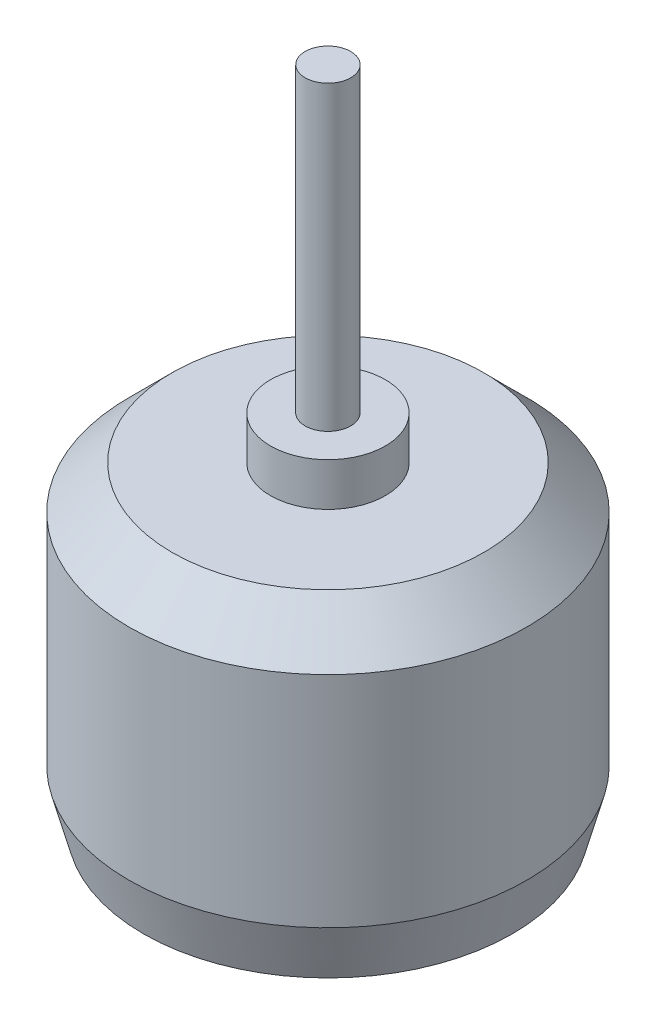
from build123d import *

# Parameters (mm, degrees)
SKETCH1_R                 = 13.85
BOSS_EXTRUDE1_DEPTH       = 22
SKETCH2_R                 = 4
BOSS_EXTRUDE2_DEPTH       = 3
SKETCH3_R                 = 1.5875
BOSS_EXTRUDE3_DEPTH       = 11
CHAMFER1_SIZE             = 3
CHAMFER2_SIZE             = 1
CHAMFER2_SIZE2            = 3.732050808
SKETCH4_R                 = 3.25
BOSS_EXTRUDE4_DEPTH       = 1
M3X0_5_TAPPED_HOLE1_D     = 2.5
M3X0_5_TAPPED_HOLE1_DEPTH = 7.5
M3X0_5_TAPPED_HOLE1_TIP   = 0.751075774
SKETCH9_R                 = 1.5875
BOSS_EXTRUDE5_DEPTH       = 10


with BuildPart() as part:
    # Sketch1 → Boss-Extrude1 (new body)
    with BuildSketch(Plane(origin=(0, 0, 0), x_dir=(1, 0, 0), z_dir=(0, 1, 0))):
        Circle(SKETCH1_R)
    extrude(amount=BOSS_EXTRUDE1_DEPTH)

    # Sketch2 → Boss-Extrude2 (add)
    with BuildSketch(Plane(origin=(0, 22, 0), x_dir=(1, 0, 0), z_dir=(0, 1, 0))):
        Circle(SKETCH2_R)
    extrude(amount=BOSS_EXTRUDE2_DEPTH)

    # Sketch3 → Boss-Extrude3 (add)
    with BuildSketch(Plane(origin=(0, 25, 0), x_dir=(1, 0, 0), z_dir=(0, 1, 0))):
        Circle(SKETCH3_R)
    extrude(amount=BOSS_EXTRUDE3_DEPTH)

    # Chamfer1
    chamfer1_edges = [part.edges().sort_by_distance(p)[0] for p in [
        (-13.85, 22, 0),
    ]]
    chamfer(chamfer1_edges, length=CHAMFER1_SIZE)

    # Chamfer2
    chamfer2_edges = [part.edges().sort_by_distance(p)[0] for p in [
        (-13.85, 0, 0),
    ]]
    chamfer2_side = [part.faces().sort_by_distance(p)[0] for p in [
        (0, 0, 0),
    ]]
    chamfer(chamfer2_edges, length=CHAMFER2_SIZE, length2=CHAMFER2_SIZE2, reference=chamfer2_side[0])

    # Sketch4 → Boss-Extrude4 (add)
    with BuildSketch(Plane.XZ):
        Circle(SKETCH4_R)
    extrude(amount=BOSS_EXTRUDE4_DEPTH)

    # M3x0.5 Tapped Hole1
    with Locations(Plane(origin=(0, 0, 0), x_dir=(-1, 0, 0), z_dir=(0, -1, 0))):
        with Locations((5.656854249, -5.656854249), (-6.717514421, -6.717514421), (-5.656854249, 5.656854249), (6.717514421, 6.717514421)):
            Hole(M3X0_5_TAPPED_HOLE1_D / 2, depth=M3X0_5_TAPPED_HOLE1_DEPTH)
            with Locations((0, 0, -(M3X0_5_TAPPED_HOLE1_DEPTH + M3X0_5_TAPPED_HOLE1_TIP / 2))):  # 118° drill point
                Cone(0, M3X0_5_TAPPED_HOLE1_D / 2, M3X0_5_TAPPED_HOLE1_TIP, mode=Mode.SUBTRACT)

    # Sketch9 → Boss-Extrude5 (add)
    with BuildSketch(Plane(origin=(0, 36, 0), x_dir=(1, 0, 0), z_dir=(0, 1, 0))):
        Circle(SKETCH9_R)
    extrude(amount=BOSS_EXTRUDE5_DEPTH)


solid = part.part
